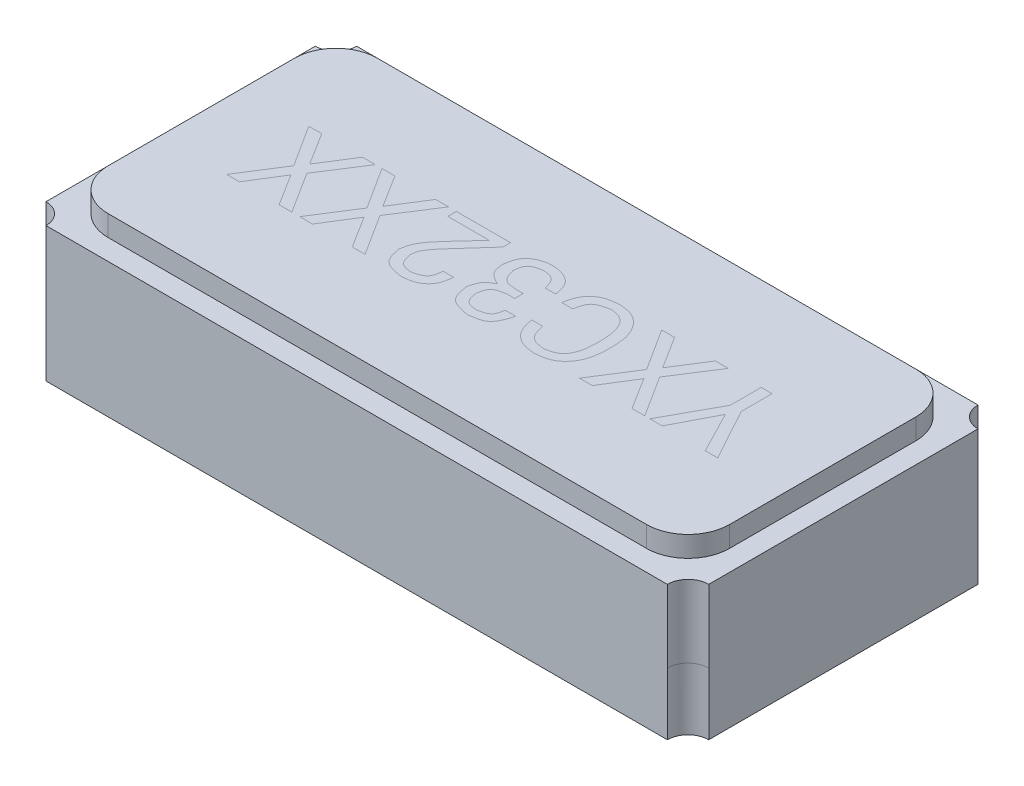
from build123d import *

# Parameters (mm, degrees)
EXTRUDE_1_DEPTH = 0.65
EXTRUDE_2_DEPTH = 0.1


with BuildPart() as part:
    # Эскиз1 → Бобышка-Вытянуть1 (new body)
    with BuildSketch(Plane(origin=(0, 0, 0), x_dir=(1, 0, 0), z_dir=(0, 1, 0))):
        with BuildLine():
            Line((-1.5, 0.75), (1.5, 0.75))
            ThreePointArc((1.5, 0.75), (1.529289322, 0.679289322), (1.6, 0.65))
            Line((1.6, 0.65), (1.6, -0.65))
            ThreePointArc((1.6, -0.65), (1.529289322, -0.679289322), (1.5, -0.75))
            Line((1.5, -0.75), (-1.5, -0.75))
            ThreePointArc((-1.5, -0.75), (-1.529289322, -0.679289322), (-1.6, -0.65))
            Line((-1.6, -0.65), (-1.6, 0.65))
            ThreePointArc((-1.6, 0.65), (-1.529289322, 0.679289322), (-1.5, 0.75))
        make_face()
    extrude(amount=EXTRUDE_1_DEPTH)

    # Эскиз2 → Бобышка-Вытянуть2 (add)
    with BuildSketch(Plane(origin=(0, 0.65, 0), x_dir=(1, 0, 0), z_dir=(0, 1, 0))):
        with BuildLine():
            Line((-1.3, 0.65), (1.3, 0.65))
            ThreePointArc((1.3, 0.65), (1.441421356, 0.591421356), (1.5, 0.45))
            Line((1.5, 0.45), (1.5, -0.45))
            ThreePointArc((1.5, -0.45), (1.441421356, -0.591421356), (1.3, -0.65))
            Line((1.3, -0.65), (-1.3, -0.65))
            ThreePointArc((-1.3, -0.65), (-1.441421356, -0.591421356), (-1.5, -0.45))
            Line((-1.5, -0.45), (-1.5, 0.45))
            ThreePointArc((-1.5, 0.45), (-1.441421356, 0.591421356), (-1.3, 0.65))
        make_face()
    extrude(amount=EXTRUDE_2_DEPTH)


solid = part.part
